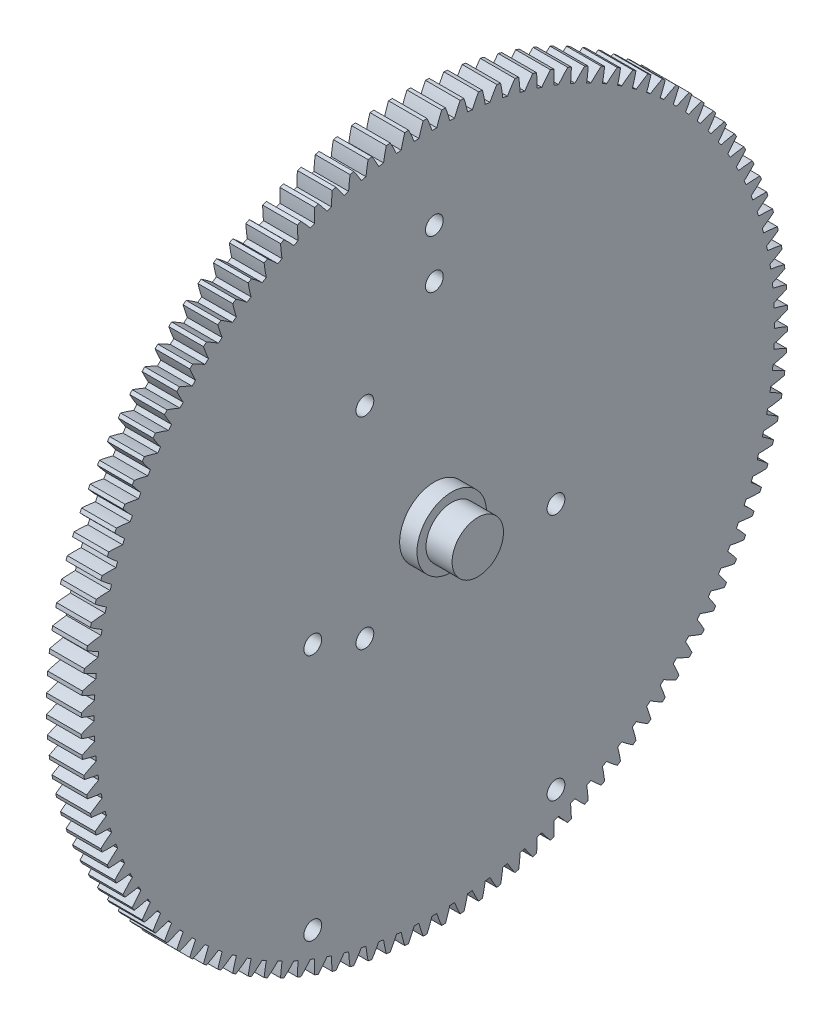
from build123d import *

# Parameters (mm, degrees)
BASPROSKE_W         = 12.7
BASPROSKE_H         = 129.116666667
TOOTHCUT_DEPTH      = 184.039660244
TEETHCUTS_COUNT     = 120
TEETHCUTS_ANGLE     = 357
SKETCH1_R           = 3.2512
CUT_EXTRUDE1_DEPTH  = 184.00052935
SKETCH2_R           = 12.699999999
BOSS_EXTRUDE1_DEPTH = 6.35
SKETCH3_R           = 9.397999999
BOSS_EXTRUDE2_DEPTH = 9.525


with BuildPart() as part:
    # BasProSke → Base-Revolve (revolve)
    with BuildSketch(Plane(origin=(0, 0, 0), x_dir=(1, 0, 0), z_dir=(0, 1, 0))):
        with Locations((6.35, 64.558333334)):
            Rectangle(BASPROSKE_W, BASPROSKE_H)
    revolve(axis=Axis((-10, 0, 0), (1, 0, 0)))

    # TooCutSke → ToothCut (cut, through all)
    with BuildSketch(Plane(origin=(0, 0, 0), x_dir=(0, 0, -1), z_dir=(1, 0, 0))):
        with BuildLine():
            ThreePointArc((0.87803111, 124.349796826), (0, 124.352896667), (-0.87803111, 124.349796826))
            ThreePointArc((-0.87803111, 124.349796826), (-1.722818551, 126.754652472), (-2.687169681, 129.114106518))
            ThreePointArc((-2.687169681, 129.114106518), (0, 129.142066667), (2.687169681, 129.114106518))
            ThreePointArc((2.687169681, 129.114106518), (1.722818551, 126.754652472), (0.87803111, 124.349796826))
        make_face()
    toothcut = extrude(amount=TOOTHCUT_DEPTH, mode=Mode.SUBTRACT)

    # TeethCuts: ToothCut ×120 about axis
    teethcuts_axis = Axis((-10, 0, 0), (1, 0, 0))
    for i in range(1, TEETHCUTS_COUNT):
        add(toothcut.rotate(teethcuts_axis, i * TEETHCUTS_ANGLE / (TEETHCUTS_COUNT - 1)), mode=Mode.SUBTRACT)

    # Sketch1 → Cut-Extrude1 (cut, through all)
    with BuildSketch(Plane.ZY):
        with Locations((25.4, 49.53)):
            Circle(SKETCH1_R)
        with Locations((25.4, -24.13)):
            Circle(SKETCH1_R)
        with Locations((0, 93.98)):
            Circle(SKETCH1_R)
        with Locations((0, 76.2)):
            Circle(SKETCH1_R)
        with Locations((44.45, -16.51)):
            Circle(SKETCH1_R)
        with Locations((44.45, -106.934)):
            Circle(SKETCH1_R)
        with Locations((-44.45, -106.934)):
            Circle(SKETCH1_R)
        with Locations((-44.45, -16.51)):
            Circle(SKETCH1_R)
    extrude(amount=-CUT_EXTRUDE1_DEPTH, mode=Mode.SUBTRACT)

    # Sketch2 → Boss-Extrude1 (add)
    with BuildSketch(Plane(origin=(12.7, 0, 0), x_dir=(0, 0, -1), z_dir=(1, 0, 0))):
        Circle(SKETCH2_R)
    extrude(amount=BOSS_EXTRUDE1_DEPTH)

    # Sketch3 → Boss-Extrude2 (add)
    with BuildSketch(Plane(origin=(19.05, 0, 0), x_dir=(0, 0, -1), z_dir=(1, 0, 0))):
        Circle(SKETCH3_R)
    extrude(amount=BOSS_EXTRUDE2_DEPTH)


solid = part.part
